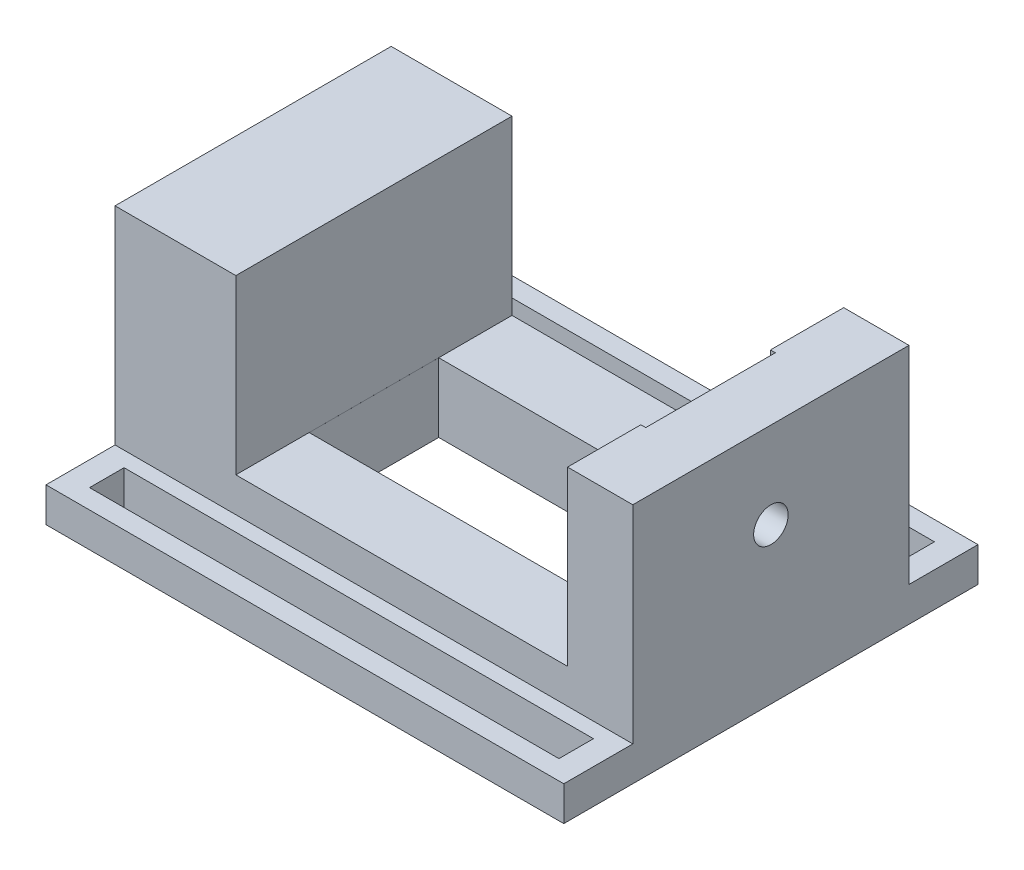
from build123d import *

# Parameters (mm, degrees)
SKETCH_1_W          = 150
SKETCH_1_H          = 80
EXTRUDE_1_DEPTH     = 60
SKETCH_2_W          = 150
SKETCH_2_H          = 120
SKETCH_2_W_2        = 135.983002124
SKETCH_2_H_2        = 10
EXTRUDE_2_DEPTH     = 10
SKETCH_3_W          = 96.092988376
SKETCH_3_H          = 50
CUT_EXTRUDE_1_DEPTH = 139.654246239
SKETCH_5_W          = 97.510223457
SKETCH_5_H          = 37.534840072
CUT_EXTRUDE_2_DEPTH = 119.84864324
SKETCH_6_R          = 5
CUT_EXTRUDE_3_DEPTH = 30


with BuildPart() as part:
    # Эскиз1 → Бобышка-Вытянуть1 (new body)
    with BuildSketch(Plane(origin=(0, 0, 0), x_dir=(1, 0, 0), z_dir=(0, 1, 0))):
        Rectangle(SKETCH_1_W, SKETCH_1_H)
    extrude(amount=EXTRUDE_1_DEPTH)

    # Эскиз2 → Бобышка-Вытянуть2 (add)
    with BuildSketch(Plane.XZ):
        Rectangle(SKETCH_2_W, SKETCH_2_H)
        with Locations((0, 49.39320085)):
            Rectangle(SKETCH_2_W_2, SKETCH_2_H_2, mode=Mode.SUBTRACT)
        with Locations((0, -49.39320085)):
            Rectangle(SKETCH_2_W_2, SKETCH_2_H_2, mode=Mode.SUBTRACT)
    extrude(amount=EXTRUDE_2_DEPTH)

    # Эскиз3 → Вырез-Вытянуть1 (cut, through all)
    with BuildSketch(Plane.XY.offset(40)):
        with Locations((8.046494188, 35)):
            Rectangle(SKETCH_3_W, SKETCH_3_H)
    extrude(amount=-CUT_EXTRUDE_1_DEPTH, mode=Mode.SUBTRACT)

    # Эскиз5 → Вырез-Вытянуть2 (cut, through all)
    with BuildSketch(Plane.XZ.offset(10)):
        with Locations((8.760111104, 0)):
            Rectangle(SKETCH_5_W, SKETCH_5_H)
    extrude(amount=-CUT_EXTRUDE_2_DEPTH, mode=Mode.SUBTRACT)

    # Эскиз6 → Вырез-Вытянуть3 (cut)
    with BuildSketch(Plane(origin=(75, 0, 0), x_dir=(0, 0, -1), z_dir=(1, 0, 0))):
        with Locations((0, 35)):
            Circle(SKETCH_6_R)
    extrude(amount=-CUT_EXTRUDE_3_DEPTH, mode=Mode.SUBTRACT)


solid = part.part
